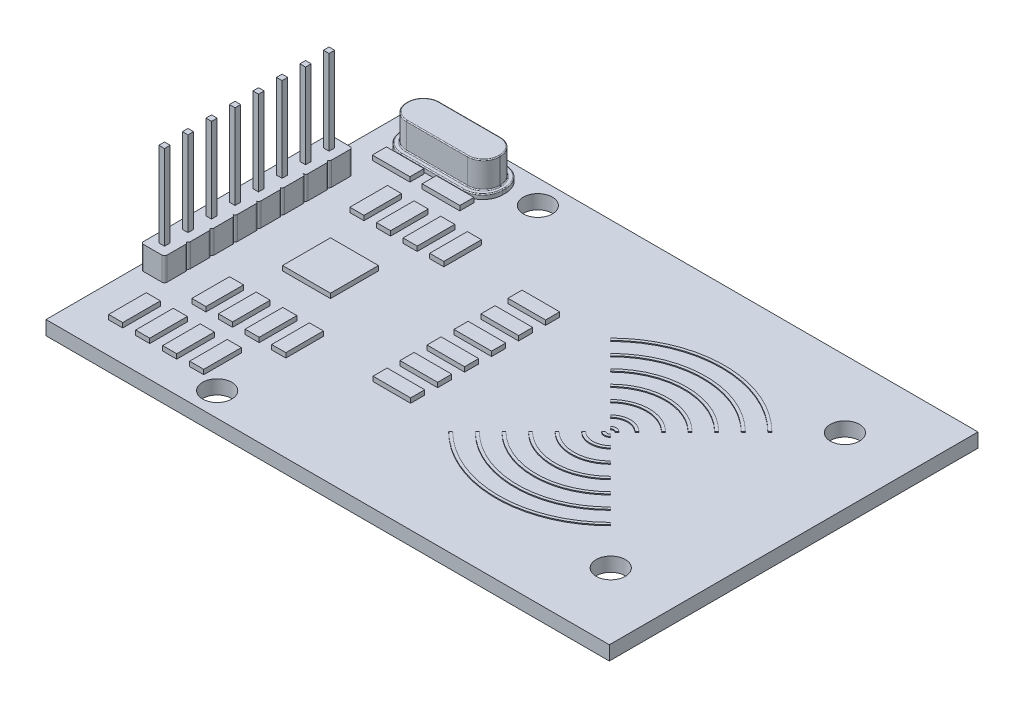
from build123d import *

# Parameters (mm, degrees)
SKETCH1_W               = 59.9
SKETCH1_H               = 39.2
BOSS_EXTRUDE1_DEPTH     = 1.5
SKETCH2_R               = 1.55
CUT_EXTRUDE4_DEPTH      = 1.5
SKETCH3_W               = 2.5
SKETCH3_H               = 2.5
BOSS_EXTRUDE2_DEPTH     = 2.5
FILLET1_R               = 0.25
LPATTERN2_START         = 1.5
LPATTERN2_DEPTH         = 2.5
SKETCH4_W               = 0.6
SKETCH4_H               = 0.6
CUT_EXTRUDE5_DEPTH      = 37.016142214
LPATTERN3_COUNT         = 8
LPATTERN3_PITCH         = 2.5
SKETCH6_W               = 0.6
SKETCH6_H               = 0.6
LPATTERN4_COUNT         = 8
LPATTERN4_PITCH         = 2.5
BOSS_EXTRUDE3_DEPTH     = 0.5
BOSS_EXTRUDE4_DEPTH     = 2.8
FILLET2_R               = 0.1
BOSS_EXTRUDE5_DEPTH     = 0.1
SKETCH14_W              = 5.1
SKETCH14_H              = 5.1
BOSS_EXTRUDE6_DEPTH     = 0.5
SKETCH15_W              = 4
SKETCH15_H              = 1.5
BOSS_EXTRUDE7_DEPTH     = 0.5
LPATTERN5_COUNT         = 6
LPATTERN5_PITCH         = 2.87
SKETCH16_W              = 1.5
SKETCH16_H              = 4
BOSS_EXTRUDE8_DEPTH     = 0.5
LPATTERN6_COUNT         = 4
LPATTERN6_PITCH         = 2.83
MIRROR2_COPY_1_SKETCH_W = 1.5
MIRROR2_COPY_1_SKETCH_H = 4
MIRROR2_COPY_1_DEPTH    = 0.5
MIRROR2_COPY_2_SKETCH_W = 1.5
MIRROR2_COPY_2_SKETCH_H = 4
MIRROR2_COPY_2_DEPTH    = 0.5
MIRROR2_COPY_3_SKETCH_W = 1.5
MIRROR2_COPY_3_SKETCH_H = 4
MIRROR2_COPY_3_DEPTH    = 0.5
SKETCH17_W              = 1.5
SKETCH17_H              = 4
BOSS_EXTRUDE9_DEPTH     = 0.5
LPATTERN7_COUNT         = 4
LPATTERN7_PITCH         = 2.87
SKETCH18_W              = 4
SKETCH18_H              = 1.5
BOSS_EXTRUDE10_DEPTH    = 0.5
LPATTERN8_COUNT         = 2
LPATTERN8_PITCH         = 5.3


# Read off the part's stored shape, not the designer's step: LPattern2
with BuildPart() as part:
    # Sketch1 → Boss-Extrude1 (new body)
    with BuildSketch(Plane(origin=(0, 0, 0), x_dir=(1, 0, 0), z_dir=(0, 1, 0))):
        Rectangle(SKETCH1_W, SKETCH1_H)
    extrude(amount=BOSS_EXTRUDE1_DEPTH)

    # Sketch2 → Cut-Extrude4 (cut)
    with BuildSketch(Plane(origin=(0, 0, 0), x_dir=(1, 0, 0), z_dir=(0, 1, 0))):
        with Locations(Location((-14.3, 17.05, 0), (0, 0, 270))):
            Circle(SKETCH2_R)
        with Locations(Location((22.95, 12.45, 0), (0, 0, 270))):
            Circle(SKETCH2_R)
        with Locations(Location((22.95, -12.45, 0), (0, 0, 90))):
            Circle(SKETCH2_R)
        with Locations(Location((-14.3, -17.05, 0), (0, 0, 90))):
            Circle(SKETCH2_R)
    extrude(amount=CUT_EXTRUDE4_DEPTH, mode=Mode.SUBTRACT)

    # Sketch3 → Boss-Extrude2 (add)
    with BuildSketch(Plane(origin=(0, 1.5, 0), x_dir=(1, 0, 0), z_dir=(0, 1, 0))):
        with Locations((-28.2, 8.75)):
            Rectangle(SKETCH3_W, SKETCH3_H)
    extrude(amount=BOSS_EXTRUDE2_DEPTH)

    # Fillet1
    fillet1_edges = [part.edges().sort_by_distance(p)[0] for p in [
        (-29.45, 2.75, -7.5),
        (-26.95, 2.75, -7.5),
        (-26.95, 2.75, -10),
        (-29.45, 2.75, -10),
    ]]
    fillet(fillet1_edges, radius=FILLET1_R)

    # LPattern2 outline → LPattern2 (add)
    with BuildSketch(Plane(origin=(0, 0, 0), x_dir=(1, 0, 0), z_dir=(0, 1, 0)).offset(LPATTERN2_START)):
        with BuildLine():
            Line((-26.95, 5.25), (-26.95, 7.25))
            ThreePointArc((-26.95, 7.25), (-27.023223305, 7.426776695), (-27.2, 7.5))
            Line((-27.2, 7.5), (-29.2, 7.5))
            ThreePointArc((-29.2, 7.5), (-29.376776695, 7.426776695), (-29.45, 7.25))
            Line((-29.45, 7.25), (-29.45, 5.25))
            ThreePointArc((-29.45, 5.25), (-29.376776695, 5.073223305), (-29.2, 5))
            ThreePointArc((-29.2, 5), (-29.376776695, 4.926776695), (-29.45, 4.75))
            Line((-29.45, 4.75), (-29.45, 2.75))
            ThreePointArc((-29.45, 2.75), (-29.376776695, 2.573223305), (-29.2, 2.5))
            ThreePointArc((-29.2, 2.5), (-29.376776695, 2.426776695), (-29.45, 2.25))
            Line((-29.45, 2.25), (-29.45, 0.25))
            ThreePointArc((-29.45, 0.25), (-29.376776695, 0.073223305), (-29.2, 0))
            ThreePointArc((-29.2, 0), (-29.376776695, -0.073223305), (-29.45, -0.25))
            Line((-29.45, -0.25), (-29.45, -2.25))
            ThreePointArc((-29.45, -2.25), (-29.376776695, -2.426776695), (-29.2, -2.5))
            ThreePointArc((-29.2, -2.5), (-29.376776695, -2.573223305), (-29.45, -2.75))
            Line((-29.45, -2.75), (-29.45, -4.75))
            ThreePointArc((-29.45, -4.75), (-29.376776695, -4.926776695), (-29.2, -5))
            ThreePointArc((-29.2, -5), (-29.376776695, -5.073223305), (-29.45, -5.25))
            Line((-29.45, -5.25), (-29.45, -7.25))
            ThreePointArc((-29.45, -7.25), (-29.376776695, -7.426776695), (-29.2, -7.5))
            ThreePointArc((-29.2, -7.5), (-29.376776695, -7.573223305), (-29.45, -7.75))
            Line((-29.45, -7.75), (-29.45, -9.75))
            ThreePointArc((-29.45, -9.75), (-29.376776695, -9.926776695), (-29.2, -10))
            Line((-29.2, -10), (-27.2, -10))
            ThreePointArc((-27.2, -10), (-27.023223305, -9.926776695), (-26.95, -9.75))
            Line((-26.95, -9.75), (-26.95, -7.75))
            ThreePointArc((-26.95, -7.75), (-27.023223305, -7.573223305), (-27.2, -7.5))
            ThreePointArc((-27.2, -7.5), (-27.023223305, -7.426776695), (-26.95, -7.25))
            Line((-26.95, -7.25), (-26.95, -5.25))
            ThreePointArc((-26.95, -5.25), (-27.023223305, -5.073223305), (-27.2, -5))
            ThreePointArc((-27.2, -5), (-27.023223305, -4.926776695), (-26.95, -4.75))
            Line((-26.95, -4.75), (-26.95, -2.75))
            ThreePointArc((-26.95, -2.75), (-27.023223305, -2.573223305), (-27.2, -2.5))
            ThreePointArc((-27.2, -2.5), (-27.023223305, -2.426776695), (-26.95, -2.25))
            Line((-26.95, -2.25), (-26.95, -0.25))
            ThreePointArc((-26.95, -0.25), (-27.023223305, -0.073223305), (-27.2, 0))
            ThreePointArc((-27.2, 0), (-27.023223305, 0.073223305), (-26.95, 0.25))
            Line((-26.95, 0.25), (-26.95, 2.25))
            ThreePointArc((-26.95, 2.25), (-27.023223305, 2.426776695), (-27.2, 2.5))
            ThreePointArc((-27.2, 2.5), (-27.023223305, 2.573223305), (-26.95, 2.75))
            Line((-26.95, 2.75), (-26.95, 4.75))
            ThreePointArc((-26.95, 4.75), (-27.023223305, 4.926776695), (-27.2, 5))
            ThreePointArc((-27.2, 5), (-27.023223305, 5.073223305), (-26.95, 5.25))
        make_face()
    extrude(amount=LPATTERN2_DEPTH)

    # Sketch4 → Cut-Extrude5 (cut, through all)
    with BuildSketch(Plane(origin=(0, 4, 0), x_dir=(1, 0, 0), z_dir=(0, 1, 0))):
        with Locations((-28.2, 8.75)):
            Rectangle(SKETCH4_W, SKETCH4_H)
    cut_extrude5 = extrude(amount=-CUT_EXTRUDE5_DEPTH, mode=Mode.SUBTRACT)

    # LPattern3: Cut-Extrude5 ×8
    with Locations(*[(0, 0, i * LPATTERN3_PITCH) for i in range(1, LPATTERN3_COUNT)]):
        add(cut_extrude5, mode=Mode.SUBTRACT)

    # Sweep1: sweep along a path in Sketch10
    with BuildLine(Plane(origin=(0, 0, -10), x_dir=(-1, 0, 0), z_dir=(0, 0, -1))) as sweep1_path:
        Line((28.2, -1), (28.2, 13))
    # Sketch6 → Sweep1 (sweep)
    with BuildSketch(Plane(origin=(0, -1, 0), x_dir=(-1, 0, 0), z_dir=(0, -1, 0))):
        with Locations((28.2, 8.75)):
            Rectangle(SKETCH6_W, SKETCH6_H)
    sweep1 = sweep(path=sweep1_path.line)

    # LPattern4: Sweep1 ×8
    with Locations(*[(0, 0, i * LPATTERN4_PITCH) for i in range(1, LPATTERN4_COUNT)]):
        add(sweep1)

    # Sketch11 → Boss-Extrude3 (add)
    with BuildSketch(Plane(origin=(0, 1.5, 0), x_dir=(1, 0, 0), z_dir=(0, 1, 0))):
        with BuildLine():
            Line((-25.85, 18.6), (-19.25, 18.6))
            ThreePointArc((-19.25, 18.6), (-17.76507576, 17.98492424), (-17.15, 16.5))
            Line((-17.15, 16.5), (-17.15, 16.15))
            ThreePointArc((-17.15, 16.15), (-17.76507576, 14.66507576), (-19.25, 14.05))
            Line((-19.25, 14.05), (-25.85, 14.05))
            ThreePointArc((-25.85, 14.05), (-27.33492424, 14.66507576), (-27.95, 16.15))
            Line((-27.95, 16.15), (-27.95, 16.5))
            ThreePointArc((-27.95, 16.5), (-27.33492424, 17.98492424), (-25.85, 18.6))
        make_face()
    extrude(amount=BOSS_EXTRUDE3_DEPTH)

    # Sketch12 → Boss-Extrude4 (add)
    with BuildSketch(Plane(origin=(0, 2, 0), x_dir=(1, 0, 0), z_dir=(0, 1, 0))):
        with BuildLine():
            Line((-25.8, 18.075), (-19.3, 18.075))
            ThreePointArc((-19.3, 18.075), (-18.097918472, 17.577081528), (-17.6, 16.375))
            Line((-17.6, 16.375), (-17.6, 16.275))
            ThreePointArc((-17.6, 16.275), (-18.097918472, 15.072918472), (-19.3, 14.575))
            Line((-19.3, 14.575), (-25.8, 14.575))
            ThreePointArc((-25.8, 14.575), (-27.002081528, 15.072918472), (-27.5, 16.275))
            Line((-27.5, 16.275), (-27.5, 16.375))
            ThreePointArc((-27.5, 16.375), (-27.002081528, 17.577081528), (-25.8, 18.075))
        make_face()
    extrude(amount=BOSS_EXTRUDE4_DEPTH)

    # Fillet2
    fillet2_edges = [part.edges().sort_by_distance(p)[0] for p in [
        (-17.76507576, 2, -17.98492424),
        (-22.55, 2, -18.6),
        (-27.33492424, 2, -17.98492424),
        (-27.95, 2, -16.325),
        (-27.33492424, 2, -14.66507576),
        (-22.55, 2, -14.05),
        (-17.76507576, 2, -14.66507576),
        (-17.15, 2, -16.325),
        (-18.097918472, 2, -15.072918472),
        (-17.6, 2, -16.325),
        (-18.097918472, 2, -17.577081528),
        (-22.55, 2, -18.075),
        (-27.002081528, 2, -17.577081528),
        (-27.5, 2, -16.325),
        (-27.002081528, 2, -15.072918472),
        (-22.55, 2, -14.575),
        (-18.097918472, 4.8, -15.072918472),
        (-17.6, 4.8, -16.325),
        (-18.097918472, 4.8, -17.577081528),
        (-22.55, 4.8, -18.075),
        (-27.002081528, 4.8, -17.577081528),
        (-27.5, 4.8, -16.325),
        (-27.002081528, 4.8, -15.072918472),
        (-22.55, 4.8, -14.575),
    ]]
    fillet(fillet2_edges, radius=FILLET2_R)

    # Sketch13 → Boss-Extrude5 (add)
    with BuildSketch(Plane(origin=(0, 1.5, 0), x_dir=(1, 0, 0), z_dir=(0, 1, 0))):
        with BuildLine():
            Line((1.858652609, -8.591347391), (2.070784643, -8.379215357))
            ThreePointArc((2.070784643, -8.379215357), (10.45, -11.85), (18.829215357, -8.379215357))
            Line((18.829215357, -8.379215357), (19.041347391, -8.591347391))
            ThreePointArc((19.041347391, -8.591347391), (10.45, -12.15), (1.858652609, -8.591347391))
        make_face()
        with BuildLine():
            Line((3.272866171, -7.177133829), (3.484998205, -6.965001795))
            ThreePointArc((3.484998205, -6.965001795), (10.45, -9.85), (17.415001795, -6.965001795))
            Line((17.415001795, -6.965001795), (17.627133829, -7.177133829))
            ThreePointArc((17.627133829, -7.177133829), (10.45, -10.15), (3.272866171, -7.177133829))
        make_face()
        with BuildLine():
            Line((4.687079733, -5.762920267), (4.899211768, -5.550788232))
            ThreePointArc((4.899211768, -5.550788232), (10.45, -7.85), (16.000788232, -5.550788232))
            Line((16.000788232, -5.550788232), (16.212920267, -5.762920267))
            ThreePointArc((16.212920267, -5.762920267), (10.45, -8.15), (4.687079733, -5.762920267))
        make_face()
        with BuildLine():
            Line((6.101293296, -4.348706704), (6.31342533, -4.13657467))
            ThreePointArc((6.31342533, -4.13657467), (10.45, -5.85), (14.58657467, -4.13657467))
            Line((14.58657467, -4.13657467), (14.798706704, -4.348706704))
            ThreePointArc((14.798706704, -4.348706704), (10.45, -6.15), (6.101293296, -4.348706704))
        make_face()
        with BuildLine():
            Line((7.515506858, -2.934493142), (7.727638892, -2.722361108))
            ThreePointArc((7.727638892, -2.722361108), (10.45, -3.85), (13.172361108, -2.722361108))
            Line((13.172361108, -2.722361108), (13.384493142, -2.934493142))
            ThreePointArc((13.384493142, -2.934493142), (10.45, -4.15), (7.515506858, -2.934493142))
        make_face()
        with BuildLine():
            Line((8.92972042, -1.52027958), (9.141852455, -1.308147545))
            ThreePointArc((9.141852455, -1.308147545), (10.45, -1.85), (11.758147545, -1.308147545))
            Line((11.758147545, -1.308147545), (11.97027958, -1.52027958))
            ThreePointArc((11.97027958, -1.52027958), (10.45, -2.15), (8.92972042, -1.52027958))
        make_face()
        with BuildLine():
            Line((9.990380592, -0.459619408), (10.202512627, -0.247487373))
            ThreePointArc((10.202512627, -0.247487373), (10.45, -0.35), (10.697487373, -0.247487373))
            Line((10.697487373, -0.247487373), (10.909619408, -0.459619408))
            ThreePointArc((10.909619408, -0.459619408), (10.45, -0.65), (9.990380592, -0.459619408))
        make_face()
    boss_extrude5 = extrude(amount=BOSS_EXTRUDE5_DEPTH)

    # Mirror1: Boss-Extrude5 across plane
    add(boss_extrude5.mirror(Plane.XY))

    # Sketch14 → Boss-Extrude6 (add)
    with BuildSketch(Plane(origin=(0, 1.5, 0), x_dir=(1, 0, 0), z_dir=(0, 1, 0))):
        with Locations((-19.3, 0)):
            Rectangle(SKETCH14_W, SKETCH14_H)
    extrude(amount=BOSS_EXTRUDE6_DEPTH)

    # Sketch15 → Boss-Extrude7 (add)
    with BuildSketch(Plane(origin=(0, 1.5, 0), x_dir=(1, 0, 0), z_dir=(0, 1, 0))):
        with Locations((-4.85, -7.18)):
            Rectangle(SKETCH15_W, SKETCH15_H)
    boss_extrude7 = extrude(amount=BOSS_EXTRUDE7_DEPTH)

    # LPattern5: Boss-Extrude7 ×6
    with Locations(*[(0, 0, -i * LPATTERN5_PITCH) for i in range(1, LPATTERN5_COUNT)]):
        add(boss_extrude7)

    # Sketch16 → Boss-Extrude8 (add)
    with BuildSketch(Plane(origin=(0, 1.5, 0), x_dir=(1, 0, 0), z_dir=(0, 1, 0))):
        with Locations((-14.4, 8.4)):
            Rectangle(SKETCH16_W, SKETCH16_H)
    boss_extrude8 = extrude(amount=BOSS_EXTRUDE8_DEPTH)

    # LPattern6: Boss-Extrude8 ×4
    with Locations(*[(-i * LPATTERN6_PITCH, 0, 0) for i in range(1, LPATTERN6_COUNT)]):
        add(boss_extrude8)

    # Mirror2: Boss-Extrude8 across plane
    add(boss_extrude8.mirror(Plane.XY))

    # Mirror2 copy 1 sketch → Mirror2 copy 1 (add)
    with BuildSketch(Plane(origin=(-2.83, 1.5, 0), x_dir=(1, 0, 0), z_dir=(0, 1, 0))):
        with Locations((-14.4, -8.4)):
            Rectangle(MIRROR2_COPY_1_SKETCH_W, MIRROR2_COPY_1_SKETCH_H)
    extrude(amount=MIRROR2_COPY_1_DEPTH)

    # Mirror2 copy 2 sketch → Mirror2 copy 2 (add)
    with BuildSketch(Plane(origin=(-5.66, 1.5, 0), x_dir=(1, 0, 0), z_dir=(0, 1, 0))):
        with Locations((-14.4, -8.4)):
            Rectangle(MIRROR2_COPY_2_SKETCH_W, MIRROR2_COPY_2_SKETCH_H)
    extrude(amount=MIRROR2_COPY_2_DEPTH)

    # Mirror2 copy 3 sketch → Mirror2 copy 3 (add)
    with BuildSketch(Plane(origin=(-8.49, 1.5, 0), x_dir=(1, 0, 0), z_dir=(0, 1, 0))):
        with Locations((-14.4, -8.4)):
            Rectangle(MIRROR2_COPY_3_SKETCH_W, MIRROR2_COPY_3_SKETCH_H)
    extrude(amount=MIRROR2_COPY_3_DEPTH)

    # Sketch17 → Boss-Extrude9 (add)
    with BuildSketch(Plane(origin=(0, 1.5, 0), x_dir=(1, 0, 0), z_dir=(0, 1, 0))):
        with Locations((-17.23, -14.3)):
            Rectangle(SKETCH17_W, SKETCH17_H)
    boss_extrude9 = extrude(amount=BOSS_EXTRUDE9_DEPTH)

    # LPattern7: Boss-Extrude9 ×4
    with Locations(*[(-i * LPATTERN7_PITCH, 0, 0) for i in range(1, LPATTERN7_COUNT)]):
        add(boss_extrude9)

    # Sketch18 → Boss-Extrude10 (add)
    with BuildSketch(Plane(origin=(0, 1.5, 0), x_dir=(1, 0, 0), z_dir=(0, 1, 0))):
        with Locations((-19.95, 13.15)):
            Rectangle(SKETCH18_W, SKETCH18_H)
    boss_extrude10 = extrude(amount=BOSS_EXTRUDE10_DEPTH)

    # LPattern8: Boss-Extrude10 ×2
    with Locations(*[(-i * LPATTERN8_PITCH, 0, 0) for i in range(1, LPATTERN8_COUNT)]):
        add(boss_extrude10)


solid = part.part
